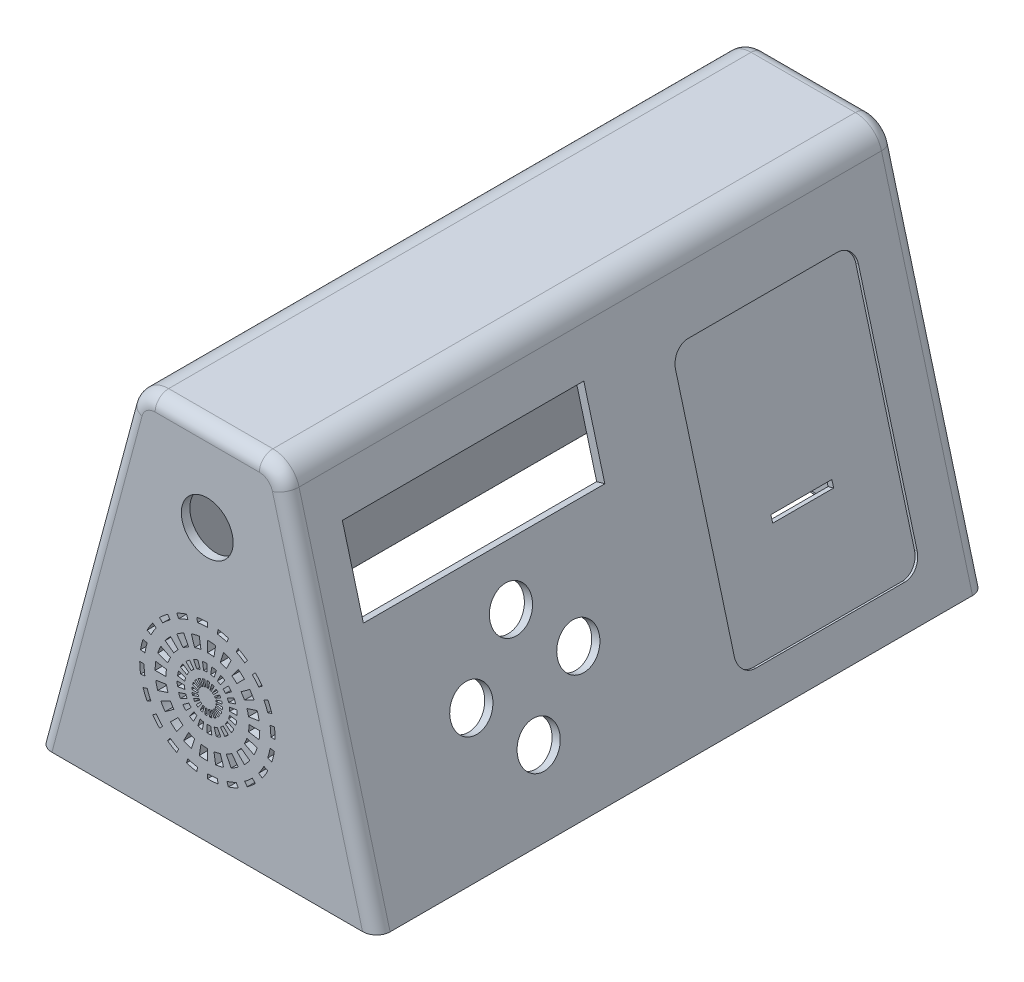
from build123d import *

# Parameters (mm, degrees)
BOSS_EXTRUDE1_DEPTH = 90
SHELL1_T            = -2.5
CUT_EXTRUDE1_REACH  = 163.959
SKETCH2_W           = 71.3
SKETCH2_H           = 24.000000000000014
CUT_EXTRUDE2_DEPTH  = 0.81
CUT_EXTRUDE3_REACH  = 163.615
SKETCH5_W           = 97
SKETCH5_H           = 177
CUT_EXTRUDE4_DEPTH  = 1.5
CUT_EXTRUDE5_REACH  = 163.959
SKETCH6_R           = 6.174999999999999
CUT_EXTRUDE6_DEPTH  = 2.54
CUT_EXTRUDE7_DEPTH  = 2.54
SKETCH14_R          = 20.000000000000004
SKETCH14_R_2        = 19.5
BOSS_EXTRUDE2_DEPTH = 3
FILLET1_R           = 4
FILLET2_R           = 8
SKETCH18_R          = 7.650000000000001
CUT_EXTRUDE8_DEPTH  = 10
CUT_EXTRUDE9_DEPTH  = 10


with BuildPart() as part:
    # Sketch1 → Boss-Extrude1 (new, symmetric)
    with BuildSketch(Plane.XY):
        Polygon((-50, 0), (50, 0), (21.529905038722262, 106.25184089179739), (-21.52990503872305, 106.25184089179761), align=None)
    extrude(amount=BOSS_EXTRUDE1_DEPTH, both=True)

    # Shell1
    shell1_openings = [part.faces().sort_by_distance(p)[0] for p in [
        (0, 0, 0),
    ]]
    offset(amount=SHELL1_T, openings=shell1_openings, kind=Kind.INTERSECTION)

    # Sketch2 → Cut-Extrude1 (cut, up to next)
    with BuildSketch(Plane(origin=(46.65063509461089, 12.500000000000195, 0), x_dir=(0, 0, -1), z_dir=(0.9659258262890673, 0.25881904510252507, 0)), mode=Mode.PRIVATE) as cut_extrude1_sk1:
        with Locations((-40.7193758454218, 66.74047186370007)):
            Rectangle(SKETCH2_W, SKETCH2_H)
    cut_extrude1_tool1 = extrude(cut_extrude1_sk1.sketch, amount=-CUT_EXTRUDE1_REACH, mode=Mode.PRIVATE) & part.part
    add(cut_extrude1_tool1.solids().sort_by_distance((29.37693, 76.966345, 40.719376))[0], mode=Mode.SUBTRACT)

    # Sketch3 → Cut-Extrude2 (cut)
    with BuildSketch(Plane(origin=(46.65063509461089, 12.500000000000195, 0), x_dir=(0, 0, -1), z_dir=(0.9659258262890673, 0.25881904510252507, 0))):
        with BuildLine():
            Line((24.790696850070674, 75.04811729460333), (68.79069685007066, 75.04811729460333))
            ThreePointArc((68.79069685007066, 75.04811729460333), (72.32623075600341, 73.58365120053605), (73.79069685007069, 70.0481172946033))
            Line((73.79069685007069, 70.0481172946033), (73.7906968500707, 3.0481172946033257))
            ThreePointArc((73.7906968500707, 3.0481172946033257), (72.3262307560034, -0.4874166113294116), (68.79069685007066, -1.951882705396674))
            Line((68.79069685007066, -1.951882705396674), (24.79069685007068, -1.9518827053966732))
            ThreePointArc((24.79069685007068, -1.9518827053966732), (21.255162944137943, -0.4874166113294116), (19.79069685007068, 3.0481172946033257))
            Line((19.79069685007068, 3.0481172946033257), (19.790696850070674, 70.0481172946033))
            ThreePointArc((19.790696850070674, 70.0481172946033), (21.255162944137915, 73.58365120053605), (24.790696850070674, 75.04811729460333))
        make_face()
    extrude(amount=-CUT_EXTRUDE2_DEPTH, mode=Mode.SUBTRACT)

    # Sketch4 → Cut-Extrude3 (cut, up to next)
    with BuildSketch(Plane(origin=(45.868235175316755, 12.29035657346716, 0), x_dir=(0, 0, -1), z_dir=(0.9659258262890672, 0.2588190451025251, 0)), mode=Mode.PRIVATE) as cut_extrude3_sk1:
        Polygon((37.79069685007067, 27.800656469375372), (55.79069685007068, 27.800656469375372), (55.790696850070674, 25.80065646937537), (37.790696850070674, 25.80065646937537), align=None)
    cut_extrude3_tool1 = extrude(cut_extrude3_sk1.sketch, amount=-CUT_EXTRUDE3_REACH, mode=Mode.PRIVATE) & part.part
    add(cut_extrude3_tool1.solids().sort_by_distance((38.931715, 38.177803, -46.790697))[0], mode=Mode.SUBTRACT)

    # Sketch5 → Cut-Extrude4 (cut)
    with BuildSketch(Plane.XZ):
        Rectangle(SKETCH5_W, SKETCH5_H)
    extrude(amount=-CUT_EXTRUDE4_DEPTH, mode=Mode.SUBTRACT)

    # Sketch6 → Cut-Extrude5 (cut, up to next)
    with BuildSketch(Plane(origin=(46.65063509461089, 12.500000000000195, 0), x_dir=(0, 0, -1), z_dir=(0.9659258262890673, 0.25881904510252507, 0)), mode=Mode.PRIVATE) as cut_extrude5_sk1:
        with Locations(Location((-36.651313768985446, 39.815157260738054, 0), (0, 0, 90))):
            Circle(SKETCH6_R)
    cut_extrude5_tool1 = extrude(cut_extrude5_sk1.sketch, amount=-CUT_EXTRUDE5_REACH, mode=Mode.PRIVATE) & part.part
    # Sketch6 → Cut-Extrude5 (cut, up to next)
    with BuildSketch(Plane(origin=(46.65063509461089, 12.500000000000195, 0), x_dir=(0, 0, -1), z_dir=(0.9659258262890673, 0.25881904510252507, 0)), mode=Mode.PRIVATE) as cut_extrude5_sk2:
        with Locations(Location((-20.85131376898545, 24.01515726073805, 0), (0, 0, 90))):
            Circle(SKETCH6_R)
    cut_extrude5_tool2 = extrude(cut_extrude5_sk2.sketch, amount=-CUT_EXTRUDE5_REACH, mode=Mode.PRIVATE) & part.part
    # Sketch6 → Cut-Extrude5 (cut, up to next)
    with BuildSketch(Plane(origin=(46.65063509461089, 12.500000000000195, 0), x_dir=(0, 0, -1), z_dir=(0.9659258262890673, 0.25881904510252507, 0)), mode=Mode.PRIVATE) as cut_extrude5_sk3:
        with Locations(Location((-36.651313768985446, 8.21515726073805, 0), (0, 0, 90))):
            Circle(SKETCH6_R)
    cut_extrude5_tool3 = extrude(cut_extrude5_sk3.sketch, amount=-CUT_EXTRUDE5_REACH, mode=Mode.PRIVATE) & part.part
    # Sketch6 → Cut-Extrude5 (cut, up to next)
    with BuildSketch(Plane(origin=(46.65063509461089, 12.500000000000195, 0), x_dir=(0, 0, -1), z_dir=(0.9659258262890673, 0.25881904510252507, 0)), mode=Mode.PRIVATE) as cut_extrude5_sk4:
        with Locations(Location((-52.45131376898545, 24.01515726073805, 0), (0, 0, 90))):
            Circle(SKETCH6_R)
    cut_extrude5_tool4 = extrude(cut_extrude5_sk4.sketch, amount=-CUT_EXTRUDE5_REACH, mode=Mode.PRIVATE) & part.part
    add(cut_extrude5_tool1.solids().sort_by_distance((36.345714, 50.958489, 36.651314))[0], mode=Mode.SUBTRACT)
    add(cut_extrude5_tool2.solids().sort_by_distance((40.435055, 35.696861, 20.851314))[0], mode=Mode.SUBTRACT)
    add(cut_extrude5_tool3.solids().sort_by_distance((44.524396, 20.435233, 36.651314))[0], mode=Mode.SUBTRACT)
    add(cut_extrude5_tool4.solids().sort_by_distance((40.435055, 35.696861, 52.451314))[0], mode=Mode.SUBTRACT)

    # Sketch7 → Cut-Extrude6 (cut)
    with BuildSketch(Plane.XY.offset(90)):
        with BuildLine():
            Line((15.509597701472817, 36.19567201132079), (12.329790586553354, 36.1956720113208))
            ThreePointArc((12.32979058655335, 36.195672011320916), (12.291977318134423, 35.233260063408814), (12.17877064425163, 34.27678170519005))
            Line((12.178770644251635, 34.276781705190146), (15.31942905699906, 33.7793502802366))
            ThreePointArc((15.31942905699913, 33.77935028023699), (15.461982148925589, 34.98377527258352), (15.509597701472819, 36.19567201132091))
        make_face()
        with BuildLine():
            ThreePointArc((11.72942942953246, 39.98620317581368), (11.990868521694535, 39.05921007883732), (12.178770644251646, 38.114562317451686))
            Line((12.178770644251662, 38.114562317451586), (15.319429056999084, 38.61199374240512))
            ThreePointArc((15.319429056999144, 38.611993742404735), (15.082817312908794, 39.80152130777108), (14.753605706738286, 40.968817613158244))
            Line((14.753605706738295, 40.96881761315822), (11.729429429532441, 39.98620317581373))
        make_face()
        with BuildLine():
            ThreePointArc((18.546819101111375, 39.12316210825091), (18.719529034367785, 37.66394325000402), (18.777217568451928, 36.195672011320916))
            Line((18.777217568451928, 36.19567201132078), (20.06337406742318, 36.195672011320774))
            ThreePointArc((20.063374067423187, 36.195672011320916), (20.00172074208575, 37.764853925877745), (19.81714087932596, 39.3243613121254))
            Line((19.817140879325954, 39.3243613121254), (18.54681910111139, 39.12316210825082))
        make_face()
        with BuildLine():
            Line((14.753605706738302, 31.422526409483613), (11.729429429532445, 32.405140846828104))
            ThreePointArc((11.72942942953246, 32.405140846828154), (11.396065226705838, 31.50151763496023), (10.992831214379992, 30.626835445787304))
            Line((10.992831214380132, 30.626835445787577), (13.826060099433963, 29.183233224609925))
            ThreePointArc((13.826060099433962, 29.183233224609907), (14.33382393751374, 30.284658133964008), (14.753605706738288, 31.422526409483588))
        make_face()
        with BuildLine():
            Line((-15.382849566626453, 36.1956720113209), (-12.203042451706985, 36.19567201132089))
            ThreePointArc((-12.203042451706985, 36.195672011320916), (-12.165229183288075, 37.15808395923279), (-12.052022509405335, 38.11456231745134))
            Line((-12.05202250940528, 38.1145623174517), (-15.1926809221527, 38.61199374240525))
            ThreePointArc((-15.192680922152794, 38.61199374240464), (-15.33523401407923, 37.40756875005821), (-15.382849566626453, 36.195672011320916))
        make_face()
        with BuildLine():
            Line((-14.626857571891932, 40.968817613158215), (-11.602681294686079, 39.98620317581373))
            ThreePointArc((-11.602681294686136, 39.98620317581354), (-11.269317091859552, 40.88982638768141), (-10.86608307953375, 41.76450857685428))
            Line((-10.866083079533771, 41.764508576854254), (-13.699311964587606, 43.2081107980319))
            ThreePointArc((-13.69931196458761, 43.208110798031896), (-14.207075802667305, 42.106685888677994), (-14.626857571891797, 40.96881761315862))
        make_face()
        with BuildLine():
            Line((-12.432883351438932, 45.27473446702675), (-9.86036535663471, 43.4056907397424))
            ThreePointArc((-9.860365356634805, 43.40569073974227), (-9.264082230258058, 44.16207227967525), (-8.610292234112105, 44.86933831285688))
            Line((-8.61029223411244, 44.86933831285654), (-10.85875540793723, 47.11780148668133))
            ThreePointArc((-10.858755407937148, 47.117801486681415), (-11.682026529900247, 46.22719180452613), (-12.432883351438809, 45.27473446702691))
        make_face()
        with BuildLine():
            Line((12.559631486285298, 27.116609555615085), (9.987113491481075, 28.985653282899428))
            ThreePointArc((9.987113491481049, 28.985653282899392), (9.390830365104367, 28.229271742966517), (8.737040368958485, 27.522005709784963))
            Line((8.73704036895881, 27.522005709785294), (10.985503542783599, 25.273542535960505))
            ThreePointArc((10.985503542783558, 25.27354253596046), (11.808774664746583, 26.164152218115667), (12.559631486285102, 27.116609555614822))
        make_face()
        with BuildLine():
            Line((-9.015688388282642, 48.69192943018303), (-7.146644660998303, 46.119411435378815))
            ThreePointArc((-7.146644660998346, 46.11941143537878), (-6.345810958030209, 46.65451140822789), (-5.5054624981098375, 47.12512915827803))
            Line((-5.5054624981101545, 47.12512915827787), (-6.949064719287808, 49.9583580433317))
            ThreePointArc((-6.949064719287864, 49.95835804333167), (-8.007255611649487, 49.365742669306954), (-9.015688388282909, 48.69192943018284))
        make_face()
        with BuildLine():
            Line((9.142436523129012, 23.699414592458808), (7.273392795844673, 26.271932587263024))
            ThreePointArc((7.273392795844904, 26.271932587263194), (6.472559092876676, 25.736832614414002), (5.632210632956217, 25.26621486436381))
            Line((5.632210632956529, 25.266214864363974), (7.075812854134185, 22.432985979310136))
            ThreePointArc((7.075812854134246, 22.432985979310168), (8.134003746495864, 23.025601353334878), (9.142436523129273, 23.699414592458993))
        make_face()
        with BuildLine():
            Line((-4.709771534414111, 50.88590365063603), (-3.727157097069624, 47.86172737343018))
            ThreePointArc((-3.72715709706954, 47.861727373430206), (-2.800164000093263, 48.12316646559226), (-1.855516238707713, 48.311068588149354))
            Line((-1.855516238707594, 48.31106858814938), (-2.35294766366114, 51.4517270008968))
            ThreePointArc((-2.3529476636607285, 51.45172700089687), (-3.5424752290270254, 51.21511525680652), (-4.709771534414128, 50.885903650636024))
        make_face()
        with BuildLine():
            Line((4.836519669260483, 21.5054403720058), (3.8539052319159968, 24.529616649211647))
            ThreePointArc((3.853905231915886, 24.52961664921162), (2.9269121349396277, 24.268177557049572), (1.9822643735540888, 24.080275434492474))
            Line((1.9822643735539587, 24.08027543449246), (2.4796957985075045, 20.939617021745043))
            ThreePointArc((2.479695798507099, 20.93961702174497), (3.6692233638733898, 21.17622876583531), (4.836519669260476, 21.5054403720058))
        make_face()
        with BuildLine():
            Line((0.06337406742318387, 51.64189564537055), (0.06337406742318442, 48.462088530451084))
            ThreePointArc((0.06337406742283792, 48.462088530451084), (1.0257860153351275, 48.42427526203217), (1.982264373554086, 48.311068588149354))
            Line((1.982264373553967, 48.31106858814938), (2.479695798507514, 51.4517270008968))
            ThreePointArc((2.4796957985070995, 51.45172700089687), (1.2752708061603342, 51.59428009282334), (0.063374067422697, 51.64189564537055))
        make_face()
        with BuildLine():
            Line((0.06337406742318923, 20.74944837727128), (0.06337406742318867, 23.929255492190748))
            ThreePointArc((0.06337406742371467, 23.929255492190748), (-0.8990378804886597, 23.967068760609656), (-1.8555162387077162, 24.080275434492474))
            Line((-1.8555162387075916, 24.080275434492453), (-2.3529476636611375, 20.939617021745036))
            ThreePointArc((-2.3529476636607387, 20.93961702174497), (-1.1485226713144554, 20.797063929818528), (0.06337406742270008, 20.74944837727128))
        make_face()
        with BuildLine():
            Line((4.836519669260479, 50.88590365063603), (3.8539052319159905, 47.86172737343017))
            ThreePointArc((3.85390523191591, 47.861727373430206), (4.757528443783552, 47.528363170603704), (5.632210632956207, 47.12512915827803))
            Line((5.632210632956522, 47.12512915827787), (7.075812854134175, 49.9583580433317))
            ThreePointArc((7.075812854134234, 49.95835804333167), (5.974387944780107, 50.46612188141147), (4.836519669260496, 50.885903650636024))
        make_face()
        with BuildLine():
            Line((-4.709771534414104, 21.505440372005808), (-3.72715709706962, 24.529616649211654))
            ThreePointArc((-3.7271570970695245, 24.52961664921162), (-4.630780308937182, 24.862980852038127), (-5.505462498109854, 25.266214864363814))
            Line((-5.505462498110155, 25.26621486436396), (-6.949064719287808, 22.43298597931013))
            ThreePointArc((-6.949064719287874, 22.43298597931016), (-5.847639809933736, 21.925222141230364), (-4.709771534414116, 21.5054403720058))
        make_face()
        with BuildLine():
            Line((9.14243652312901, 48.69192943018304), (7.273392795844666, 46.11941143537881))
            ThreePointArc((7.2733927958449005, 46.11941143537864), (8.02977433577733, 45.52312830900232), (8.737040368958487, 44.86933831285687))
            Line((8.737040368958809, 44.86933831285655), (10.985503542783594, 47.11780148668133))
            ThreePointArc((10.985503542783555, 47.11780148668137), (10.09489386062837, 47.94107260864437), (9.142436523129257, 48.69192943018285))
        make_face()
        with BuildLine():
            Line((-9.015688388282639, 23.6994145924588), (-7.1466446609983, 26.271932587263017))
            ThreePointArc((-7.14664466099834, 26.271932587263052), (-7.903026200930869, 26.868215713639437), (-8.61029223411211, 27.522005709784956))
            Line((-8.610292234112444, 27.522005709785287), (-10.85875540793723, 25.2735425359605))
            ThreePointArc((-10.858755407937137, 25.273542535960406), (-9.96814572578198, 24.45027141399744), (-9.0156883882829, 23.699414592458986))
        make_face()
        with BuildLine():
            Line((12.559631486285292, 45.27473446702675), (9.987113491481072, 43.40569073974241))
            ThreePointArc((9.987113491480905, 43.40569073974264), (10.522213464329925, 42.60485703677469), (10.992831214379992, 41.764508576854524))
            Line((10.992831214380129, 41.764508576854254), (13.826060099433969, 43.20811079803191))
            ThreePointArc((13.826060099433965, 43.20811079803192), (13.233444725409242, 44.26630169039356), (12.55963148628511, 45.274734467027))
        make_face()
        with BuildLine():
            Line((-12.432883351438925, 27.11660955561509), (-9.86036535663471, 28.985653282899428))
            ThreePointArc((-9.8603653566348, 28.985653282899555), (-10.395465329483747, 29.786486985867448), (-10.866083079533752, 30.626835445787552))
            Line((-10.86608307953377, 30.626835445787574), (-13.699311964587608, 29.183233224609918))
            ThreePointArc((-13.69931196458761, 29.183233224609936), (-13.106696590562914, 28.125042332248334), (-12.43288335143881, 27.116609555614925))
        make_face()
        with BuildLine():
            Line((-14.626857571891925, 31.422526409483616), (-11.602681294686079, 32.405140846828104))
            ThreePointArc((-11.602681294686137, 32.40514084682829), (-11.864120386848226, 33.33213394380474), (-12.05202250940533, 34.276781705190466))
            Line((-12.052022509405276, 34.2767817051901), (-15.192680922152697, 33.779350280236564))
            ThreePointArc((-15.19268092215279, 33.77935028023717), (-14.956069178062391, 32.589822714870586), (-14.626857571891799, 31.42252640948322))
        make_face()
        with BuildLine():
            Line((19.817140879325944, 33.06698271051631), (18.54681910111137, 33.268181914390894))
            ThreePointArc((18.546819101111353, 33.268181914390794), (18.26015258285303, 31.827012006080583), (17.861296874004175, 30.41277633942955))
            Line((17.861296874004285, 30.41277633942986), (19.08450439332626, 30.01533212382196))
            ThreePointArc((19.084504393326256, 30.015332123821963), (19.51077247537672, 31.52676473420281), (19.817140879325944, 33.066982710516314))
        make_face()
        with BuildLine():
            ThreePointArc((16.73753071947971, 44.69157917440096), (17.352711052642864, 43.357149875038054), (17.861296874004175, 41.97856768321229))
            Line((17.861296874004278, 41.97856768321197), (19.084504393326256, 42.376011898819876))
            ThreePointArc((19.084504393326256, 42.376011898819876), (18.54096471764892, 43.84934065862272), (17.883504551190544, 45.27548200611186))
            Line((17.883504551190537, 45.27548200611185), (16.73753071947988, 44.69157917440063))
        make_face()
        with BuildLine():
            ThreePointArc((-18.420070966265097, 33.26818191439149), (-18.592780899521443, 34.7274007726381), (-18.65046943360556, 36.195672011320916))
            Line((-18.65046943360556, 36.19567201132091), (-19.93662593257682, 36.195672011320916))
            ThreePointArc((-19.93662593257682, 36.195672011320916), (-19.87497260723938, 34.62649009676401), (-19.690392744479574, 33.06698271051629))
            Line((-19.690392744479574, 33.066982710516285), (-18.420070966265, 33.268181914390865))
        make_face()
        with BuildLine():
            Line((-19.690392744479578, 39.32436131212554), (-18.420070966264998, 39.12316210825095))
            ThreePointArc((-18.4200709662651, 39.12316210825031), (-18.13340444800684, 40.56433201656053), (-17.734548739158043, 41.978567683211566))
            Line((-17.734548739157916, 41.97856768321196), (-18.957756258479893, 42.37601189881987))
            ThreePointArc((-18.95775625847989, 42.37601189881987), (-19.38402434053035, 40.86457928843903), (-19.690392744479574, 39.324361312125546))
        make_face()
        with BuildLine():
            Line((-17.75675641634418, 45.27548200611185), (-16.61078258463351, 44.69157917440062))
            ThreePointArc((-16.610782584633345, 44.69157917440096), (-15.892800530990655, 45.97362838092744), (-15.076443354982297, 47.19539323493487))
            Line((-15.076443354982237, 47.195393234934954), (-16.11696582007577, 47.95137705717038))
            ThreePointArc((-16.116965820075766, 47.95137705717038), (-16.989429219658664, 46.645643305639894), (-17.756756416344174, 45.27548200611186))
        make_face()
        with BuildLine():
            Line((17.883504551190548, 27.115862016529977), (16.737530719479885, 27.699764848241205))
            ThreePointArc((16.737530719479714, 27.699764848240875), (16.019548665837025, 26.417715641714402), (15.203191489828669, 25.19595078770697))
            Line((15.203191489828598, 25.195950787706874), (16.243713954922136, 24.439966965471445))
            ThreePointArc((16.243713954922132, 24.43996696547145), (17.11617735450503, 25.745700717001938), (17.88350455119054, 27.115862016529974))
        make_face()
        with BuildLine():
            Line((-14.07876155630777, 50.337807635051874), (-13.169311574218039, 49.42835765296214))
            ThreePointArc((-13.169311574217724, 49.42835765296246), (-12.090295071076216, 50.425790248808724), (-10.936347156190767, 51.3354894337264))
            Line((-10.936347156190854, 51.33548943372633), (-11.692330978426282, 52.37601189881987))
            ThreePointArc((-11.692330978426279, 52.37601189881987), (-12.925586899180491, 51.40379132332154), (-14.078761556307768, 50.337807635051874))
        make_face()
        with BuildLine():
            Line((14.20550969115414, 22.053536387589965), (13.296059709064407, 22.962986369679697))
            ThreePointArc((13.29605970906476, 22.96298636968004), (12.217043205922934, 21.96555377383341), (11.063095291037126, 21.055854588915427))
            Line((11.063095291037227, 21.0558545889155), (11.819079113272652, 20.01533212382197))
            ThreePointArc((11.819079113272643, 20.015332123821963), (13.052335034026862, 20.987552699320297), (14.205509691154132, 22.053536387589958))
        make_face()
        with BuildLine():
            Line((-9.016435927367759, 54.01580249508828), (-8.43253309565653, 52.86982866337762))
            ThreePointArc((-8.432533095656748, 52.869828663377504), (-7.098103796293788, 53.48500899654067), (-5.719521604467964, 53.99359481790198))
            Line((-5.719521604467863, 53.99359481790202), (-6.116965820075766, 55.216802337223996))
            ThreePointArc((-6.116965820075765, 55.216802337223996), (-7.590294579878613, 54.67326266154666), (-9.016435927367752, 54.01580249508828))
        make_face()
        with BuildLine():
            Line((9.143184062214129, 18.375541527553565), (8.559281230502904, 19.52151535926422))
            ThreePointArc((8.55928123050311, 19.521515359264328), (7.224851931140149, 18.90633502610116), (5.846269739314336, 18.397749204739853))
            Line((5.846269739314232, 18.39774920473981), (6.243713954922136, 17.174541685417836))
            ThreePointArc((6.2437139549221286, 17.17454168541784), (7.717042714724984, 17.71808136109518), (9.143184062214132, 18.375541527553562))
        make_face()
        with BuildLine():
            Line((-3.065315233381431, 55.94943882322367), (-2.8641160295068473, 54.67911704500911))
            ThreePointArc((-2.8641160295074557, 54.679117045009), (-1.4048971712602951, 54.85182697826549), (0.06337406742308034, 54.90951551234966))
            Line((0.0633740674231833, 54.90951551234966), (0.06337406742318308, 56.195672011320916))
            ThreePointArc((0.0633740674231843, 56.19567201132092), (-1.5058078471337146, 56.13401868598348), (-3.0653152333814293, 55.94943882322367))
        make_face()
        with BuildLine():
            Line((3.1920633682277972, 16.44190519941816), (2.990864164353211, 17.71222697763274))
            ThreePointArc((2.99086416435382, 17.712226977632827), (1.5316453061065598, 17.539517044376336), (0.06337406742307991, 17.48182851029217))
            Line((0.0633740674231898, 17.481828510292168), (0.06337406742319002, 16.195672011320916))
            ThreePointArc((0.0633740674231794, 16.195672011320912), (1.6325559819800874, 16.257325336658354), (3.1920633682277972, 16.44190519941816))
        make_face()
        with BuildLine():
            Line((3.1920633682278043, 55.949438823223666), (2.9908641643532214, 54.67911704500911))
            ThreePointArc((2.990864164353828, 54.679117045009), (4.432034072663666, 54.39245052675073), (5.846269739314333, 53.99359481790198))
            Line((5.846269739314227, 53.993594817902014), (6.243713954922132, 55.216802337223996))
            ThreePointArc((6.243713954922129, 55.216802337223996), (4.732281344541294, 55.64307041927445), (3.1920633682278066, 55.94943882322367))
        make_face()
        with BuildLine():
            Line((-3.065315233381432, 16.44190519941815), (-2.8641160295068437, 17.71222697763274))
            ThreePointArc((-2.8641160295074606, 17.71222697763283), (-4.305285937817294, 17.998893495891103), (-5.719521604467961, 18.39774920473985))
            Line((-5.719521604467856, 18.39774920473981), (-6.116965820075759, 17.174541685417836))
            ThreePointArc((-6.1169658200757695, 17.174541685417843), (-4.60553320969492, 16.74827360336738), (-3.065315233381438, 16.44190519941816))
        make_face()
        with BuildLine():
            Line((9.143184062214122, 54.01580249508828), (8.559281230502892, 52.86982866337762))
            ThreePointArc((8.559281230503112, 52.869828663377504), (9.841330437029647, 52.15184660973479), (11.063095291037131, 51.3354894337264))
            Line((11.063095291037216, 51.33548943372633), (11.819079113272645, 52.37601189881987))
            ThreePointArc((11.819079113272645, 52.37601189881987), (10.513345361742163, 53.24847529840277), (9.143184062214122, 54.01580249508827))
        make_face()
        with BuildLine():
            Line((-9.016435927367755, 18.37554152755355), (-8.432533095656527, 19.521515359264214))
            ThreePointArc((-8.432533095656751, 19.52151535926433), (-9.714582302183276, 20.23949741290704), (-10.93634715619075, 21.05585458891542))
            Line((-10.93634715619085, 21.055854588915494), (-11.692330978426279, 20.015332123821956))
            ThreePointArc((-11.692330978426284, 20.015332123821967), (-10.386597226895791, 19.142868724239065), (-9.016435927367757, 18.37554152755356))
        make_face()
        with BuildLine():
            Line((14.205509691154132, 50.337807635051874), (13.296059709064407, 49.42835765296215))
            ThreePointArc((13.29605970906476, 49.42835765296179), (14.293492304911004, 48.3493411498203), (15.203191489828662, 47.19539323493487))
            Line((15.203191489828594, 47.19539323493496), (16.24371395492213, 47.95137705717039))
            ThreePointArc((16.243713954922132, 47.95137705717039), (15.2714933794238, 49.1846329779246), (14.20550969115413, 50.337807635051874))
        make_face()
        with BuildLine():
            Line((-14.078761556307773, 22.053536387589958), (-13.16931157421804, 22.962986369679687))
            ThreePointArc((-13.16931157421773, 22.962986369679374), (-14.16674417006433, 24.042002872821175), (-15.076443354982295, 25.19595078770696))
            Line((-15.076443354982228, 25.195950787706874), (-16.116965820075762, 24.43996696547145))
            ThreePointArc((-16.116965820075766, 24.43996696547145), (-15.144745244577434, 23.20671104471724), (-14.078761556307773, 22.053536387589965))
        make_face()
        with BuildLine():
            Line((-17.756756416344178, 27.115862016529974), (-16.610782584633522, 27.699764848241198))
            ThreePointArc((-16.610782584633345, 27.699764848240868), (-17.22596291779664, 29.03419414760412), (-17.73454873915804, 30.412776339430252))
            Line((-17.7345487391579, 30.41277633942987), (-18.95775625847989, 30.01533212382196))
            ThreePointArc((-18.95775625847989, 30.01533212382196), (-18.414216582802553, 28.542003364019113), (-17.756756416344178, 27.11586201652998))
        make_face()
    extrude(amount=-CUT_EXTRUDE6_DEPTH, mode=Mode.SUBTRACT)

    # Sketch8 → Cut-Extrude7 (cut)
    with BuildSketch(Plane.XY.offset(90)):
        with BuildLine():
            Line((4.503210936806557, 36.733163223486926), (2.6365823360693508, 36.733163223486926))
            ThreePointArc((2.6365823360693503, 36.733163223486926), (2.6283620603261064, 36.5239432348104), (2.6037519138298517, 36.316013156936776))
            Line((2.6037519138298446, 36.31601315693676), (4.447399218999401, 36.024008110351645))
            ThreePointArc((4.44739921899941, 36.02400811035167), (4.4892364680430425, 36.377489242736836), (4.503210936806557, 36.733163223486926))
        make_face()
        with BuildLine():
            ThreePointArc((2.5060690410648063, 37.5571917375071), (2.5629036263174405, 37.355671499033946), (2.603751913829859, 37.15031329003703))
            Line((2.603751913829859, 37.15031329003705), (4.447399218999412, 37.442318336622165))
            ThreePointArc((4.447399218999415, 37.44231833662214), (4.3779571302283, 37.7914272919169), (4.281338335298816, 38.13401169732127))
            Line((4.281338335298835, 38.13401169732122), (2.5060690410648077, 37.5571917375071))
        make_face()
        with BuildLine():
            ThreePointArc((6.555741469891258, 37.776246944042185), (6.617279139974874, 37.25631779471364), (6.637833939059922, 36.733163223486926))
            Line((6.637833939059922, 36.733163223486926), (8.834200022724662, 36.733163223486926))
            ThreePointArc((8.834200022724662, 36.733163223486926), (8.806874560003799, 37.4286426915253), (8.72506664240552, 38.119834297372826))
            Line((8.72506664240552, 38.119834297372826), (6.555741469891251, 37.776246944042235))
        make_face()
        with BuildLine():
            Line((-4.563270838202682, 36.733163223486926), (-2.6966422374654755, 36.733163223486926))
            ThreePointArc((-2.696642237465476, 36.733163223486926), (-2.6884219617222302, 36.94238321216348), (-2.6638118152259684, 37.15031329003713))
            Line((-2.6638118152259764, 37.1503132900371), (-4.507459120395532, 37.442318336622215))
            ThreePointArc((-4.50745912039552, 37.44231833662228), (-4.549296369439164, 37.088837204237066), (-4.563270838202682, 36.733163223486926))
        make_face()
        with BuildLine():
            Line((-4.341398236694959, 38.13401169732122), (-2.5661289424609324, 37.55719173750709))
            ThreePointArc((-2.566128942460939, 37.557191737507075), (-2.493658463585617, 37.753631566173944), (-2.405998895688734, 37.943779868167994))
            Line((-2.4059988956886933, 37.94377986816807), (-4.069177157182152, 38.791211519444886))
            ThreePointArc((-4.069177157182104, 38.79121151944498), (-4.218198422606871, 38.46795940605499), (-4.341398236694969, 38.134011697321185))
        make_face()
        with BuildLine():
            Line((4.281338335298825, 35.332314749652625), (2.5060690410648068, 35.90913470946675))
            ThreePointArc((2.5060690410648014, 35.90913470946674), (2.4335985621894745, 35.712694880799866), (2.3459389942925877, 35.522546578805816))
            Line((2.3459389942925597, 35.522546578805766), (4.009117255786014, 34.67511492752895))
            ThreePointArc((4.009117255786027, 34.67511492752897), (4.1581385212107485, 34.99836704091887), (4.281338335298814, 35.33231474965258))
        make_face()
        with BuildLine():
            Line((-3.6974988682846712, 39.397735362251375), (-2.1873646081019427, 38.30055859923071))
            ThreePointArc((-2.18736460810193, 38.30055859923073), (-2.0577378414983216, 38.46498936878134), (-1.9156095814666316, 38.618742854255565))
            Line((-1.9156095814666667, 38.61874285425553), (-3.2355153230047016, 39.938648595793566))
            ThreePointArc((-3.235515323004686, 39.93864859579358), (-3.477133365058535, 39.67726767048741), (-3.6974988682846486, 39.39773536225141))
        make_face()
        with BuildLine():
            Line((3.6374389668885394, 34.068591084722456), (2.1273047067058135, 35.16576784774312))
            ThreePointArc((2.12730470670578, 35.16576784774308), (1.997677940102193, 35.00133707819251), (1.8555496800705296, 34.84758359271831))
            Line((1.8555496800705402, 34.84758359271832), (3.175455421608577, 33.527677851180286))
            ThreePointArc((3.1754554216086754, 33.527677851180385), (3.4170734636624607, 33.7890587764865), (3.6374389668885194, 34.068591084722435))
        make_face()
        with BuildLine():
            Line((-2.6946020894625207, 40.40063214107353), (-1.5974253264418556, 38.890497880890806))
            ThreePointArc((-1.597425326441834, 38.89049788089082), (-1.4233310431879804, 39.00682396194492), (-1.2406465953793027, 39.10913216847751))
            Line((-1.2406465953792187, 39.10913216847756), (-2.0880782466560333, 40.772310429971014))
            ThreePointArc((-2.088078246655972, 40.77231042997104), (-2.398641807930844, 40.59838647886558), (-2.694602089462505, 40.400632141073544))
        make_face()
        with BuildLine():
            Line((2.634542188066396, 33.06569430590032), (1.5373654250457314, 34.57582856608305))
            ThreePointArc((1.5373654250457656, 34.575828566083075), (1.363271141791888, 34.459502485028956), (1.1805866939831853, 34.357194278496344))
            Line((1.1805866939830887, 34.3571942784963), (2.028018345259909, 32.69401601700284))
            ThreePointArc((2.028018345259844, 32.69401601700281), (2.3385819065347384, 32.86793996810829), (2.634542188066417, 33.06569430590034))
        make_face()
        with BuildLine():
            Line((-1.4308784245323622, 41.044531509483825), (-0.8540584647182365, 39.269262215249796))
            ThreePointArc((-0.8540584647182847, 39.26926221524978), (-0.652538226245091, 39.32609680050243), (-0.447180017248139, 39.36694508801485))
            Line((-0.4471800172482311, 39.36694508801484), (-0.7391850638333511, 41.21059239318439))
            ThreePointArc((-0.739185063833355, 41.21059239318439), (-1.088294019128091, 41.14115030441327), (-1.4308784245324413, 41.04453150948379))
        make_face()
        with BuildLine():
            Line((1.370818523136231, 32.42179493749004), (0.7939985633221056, 34.19706423172406))
            ThreePointArc((0.7939985633221577, 34.19706423172407), (0.5924783248489638, 34.140229646471425), (0.3871201158520148, 34.099381358959))
            Line((0.38712011585210404, 34.099381358959015), (0.6791251624372243, 32.25573405378946))
            ThreePointArc((0.6791251624372308, 32.25573405378946), (1.0282341177319647, 32.32517614256058), (1.3708185231363172, 32.42179493749006))
        make_face()
        with BuildLine():
            Line((-0.0300299506980628, 41.266404110991544), (-0.0300299506980628, 39.39977551025434))
            ThreePointArc((-0.03002995069814612, 39.39977551025434), (0.17919003797838373, 39.3915552345111), (0.3871201158520172, 39.36694508801485))
            Line((0.38712011585210526, 39.36694508801484), (0.679125162437223, 41.21059239318439))
            ThreePointArc((0.6791251624372289, 41.21059239318439), (0.3256440300520442, 41.25242964222803), (-0.03002995069806554, 41.266404110991544))
        make_face()
        with BuildLine():
            Line((-0.0300299506980628, 32.19992233598231), (-0.0300299506980628, 34.066550936719516))
            ThreePointArc((-0.0300299506979804, 34.066550936719516), (-0.23924993937450437, 34.07477121246275), (-0.447180017248132, 34.099381358959))
            Line((-0.4471800172482232, 34.099381358959015), (-0.7391850638333413, 32.25573405378946))
            ThreePointArc((-0.73918506383335, 32.25573405378946), (-0.38570393144817133, 32.21389680474582), (-0.03002995069806363, 32.19992233598231))
        make_face()
        with BuildLine():
            Line((1.3708185231362366, 41.044531509483825), (0.7939985633221109, 39.269262215249796))
            ThreePointArc((0.7939985633221595, 39.26926221524978), (0.9904383919890847, 39.19679173637443), (1.1805866939831837, 39.10913216847751))
            Line((1.1805866939830882, 39.109132168477544), (2.0280183452599063, 40.772310429971014))
            ThreePointArc((2.028018345259845, 40.77231042997104), (1.7047662318699792, 40.92133169539574), (1.3708185231363164, 41.04453150948379))
        make_face()
        with BuildLine():
            Line((-1.4308784245323567, 32.42179493749004), (-0.8540584647182312, 34.19706423172406))
            ThreePointArc((-0.8540584647182842, 34.19706423172407), (-1.0504982933852045, 34.26953471059942), (-1.240646595379301, 34.357194278496344))
            Line((-1.2406465953792143, 34.35719427849629), (-2.088078246656025, 32.69401601700284))
            ThreePointArc((-2.088078246655964, 32.69401601700281), (-1.7648261332661026, 32.54499475157811), (-1.4308784245324444, 32.42179493749006))
        make_face()
        with BuildLine():
            Line((2.634542188066398, 40.40063214107353), (1.5373654250457345, 38.890497880890806))
            ThreePointArc((1.5373654250457698, 38.89049788089078), (1.7017961945963354, 38.7608711142872), (1.8555496800705316, 38.618742854255544))
            Line((1.8555496800705482, 38.61874285425553), (3.17545542160858, 39.938648595793566))
            ThreePointArc((3.175455421608683, 39.93864859579346), (2.914074496302471, 40.18026663784736), (2.6345421880664195, 40.400632141073515))
        make_face()
        with BuildLine():
            Line((-2.694602089462517, 33.06569430590032), (-1.5974253264418508, 34.57582856608305))
            ThreePointArc((-1.5974253264418325, 34.57582856608303), (-1.7618560959924143, 34.70545533268662), (-1.9156095814666263, 34.84758359271828))
            Line((-1.915609581466664, 34.847583592718316), (-3.235515323004697, 33.52767785118028))
            ThreePointArc((-3.235515323004681, 33.527677851180265), (-2.974134397698508, 33.28605980912642), (-2.6946020894625047, 33.06569430590031))
        make_face()
        with BuildLine():
            Line((3.637438966888538, 39.39773536225139), (2.1273047067058073, 38.30055859923072))
            ThreePointArc((2.1273047067057873, 38.300558599230754), (2.2436307877599506, 38.126464315976804), (2.3459389942925952, 37.94377986816802))
            Line((2.3459389942925695, 37.94377986816807), (4.009117255786021, 38.791211519444886))
            ThreePointArc((4.009117255786034, 38.791211519444865), (3.8351933046805664, 39.10177508071975), (3.637438966888524, 39.39773536225141))
        make_face()
        with BuildLine():
            Line((-3.6974988682846686, 34.06859108472247), (-2.1873646081019427, 35.16576784774313))
            ThreePointArc((-2.187364608101926, 35.16576784774311), (-2.303690689156086, 35.33986213099706), (-2.4059988956887275, 35.522546578805844))
            Line((-2.4059988956886906, 35.522546578805766), (-4.069177157182147, 34.67511492752895))
            ThreePointArc((-4.069177157182191, 34.675114927529044), (-3.895253206076707, 34.36455136625413), (-3.6974988682846446, 34.068591084722435))
        make_face()
        with BuildLine():
            Line((-4.3413982366949515, 35.332314749652625), (-2.566128942460926, 35.909134709466755))
            ThreePointArc((-2.566128942460937, 35.90913470946677), (-2.6229635277135523, 36.11065494793986), (-2.663811815225964, 36.31601315693669))
            Line((-2.663811815225964, 36.316013156936734), (-4.50745912039552, 36.024008110351616))
            ThreePointArc((-4.5074591203955165, 36.02400811035156), (-4.438017031624417, 35.67489915505692), (-4.341398236694966, 35.33231474965266))
        make_face()
        with BuildLine():
            Line((8.72506664240551, 35.34649214960097), (6.555741469891235, 35.69007950293157))
            ThreePointArc((6.555741469891249, 35.69007950293162), (6.4536003290084505, 35.17658131160072), (6.311485451425403, 34.67267996537262))
            Line((6.3114854514254155, 34.67267996537266), (8.400353727464438, 33.9939655196515))
            ThreePointArc((8.40035372746443, 33.993965519651496), (8.58928064294569, 34.66384983203883), (8.725066642405512, 35.34649214960097))
        make_face()
        with BuildLine():
            ThreePointArc((5.91108027747636, 39.76031008299337), (6.130273022620441, 39.284844263362736), (6.311485451425408, 38.793646481601215))
            Line((6.311485451425417, 38.79364648160118), (8.400353727464433, 39.472360927322335))
            ThreePointArc((8.400353727464436, 39.472360927322335), (8.159450693220261, 40.12535717498984), (7.868056787527671, 40.75743941892737))
            Line((7.868056787527666, 40.75743941892737), (5.911080277476334, 39.76031008299343))
        make_face()
        with BuildLine():
            ThreePointArc((-6.6158013712874, 35.69007950293178), (-6.677339041371004, 36.21000865226027), (-6.697893840456047, 36.733163223486926))
            Line((-6.697893840456047, 36.733163223486926), (-8.894259924120789, 36.733163223486926))
            ThreePointArc((-8.894259924120789, 36.733163223486926), (-8.866934461399923, 36.03768375544852), (-8.785126543801637, 35.346492149600955))
            Line((-8.785126543801637, 35.346492149600955), (-6.615801371287358, 35.69007950293155))
        make_face()
        with BuildLine():
            Line((-8.785126543801637, 38.11983429737289), (-6.6158013712873665, 37.77624694404229))
            ThreePointArc((-6.615801371287402, 37.776246944042065), (-6.513660230404627, 38.289745135372925), (-6.371545352821608, 38.79364648160099))
            Line((-6.371545352821544, 38.79364648160118), (-8.460413628860561, 39.472360927322335))
            ThreePointArc((-8.460413628860563, 39.472360927322335), (-8.649340544341817, 38.80247661493502), (-8.785126543801637, 38.11983429737289))
        make_face()
        with BuildLine():
            Line((-7.928116688923794, 40.75743941892737), (-5.971140178872459, 39.76031008299342))
            ThreePointArc((-5.971140178872551, 39.76031008299324), (-5.715318513552086, 40.21711253560668), (-5.424445153691325, 40.65243528218018))
            Line((-5.424445153691317, 40.65243528218019), (-7.201342641244836, 41.9434268747937))
            ThreePointArc((-7.201342641244839, 41.9434268747937), (-7.588028452109688, 41.36471066191239), (-7.928116688923797, 40.757439418927376))
        make_face()
        with BuildLine():
            Line((7.868056787527667, 32.70888702804646), (5.911080277476323, 33.70601636398041))
            ThreePointArc((5.911080277476353, 33.70601636398047), (5.655258612155883, 33.24921391136704), (5.364385252295117, 32.81389116479356))
            Line((5.364385252295185, 32.813891164793645), (7.1412827398487115, 31.52289957218013))
            ThreePointArc((7.1412827398487, 31.522899572180133), (7.5279685507135525, 32.10161578506145), (7.868056787527664, 32.70888702804646))
        make_face()
        with BuildLine():
            Line((-6.297987074902318, 43.001120347691185), (-4.744921723174842, 41.44805499596371))
            ThreePointArc((-4.744921723174793, 41.44805499596376), (-4.360461140432694, 41.80344670306792), (-3.94930200939139, 42.127578426480135))
            Line((-3.9493020093913325, 42.12757842648018), (-5.240293602004842, 43.904475914033696))
            ThreePointArc((-5.240293602004845, 43.904475914033696), (-5.78688680688737, 43.47357657572817), (-6.297987074902322, 43.001120347691185))
        make_face()
        with BuildLine():
            Line((6.237927173506195, 30.46520609928266), (4.684861821778712, 32.01827145101015))
            ThreePointArc((4.684861821778847, 32.01827145101027), (4.300401239036676, 31.66287974390602), (3.889242107995285, 31.338748020493735))
            Line((3.889242107995207, 31.33874802049368), (5.180233700608715, 29.56185053294016))
            ThreePointArc((5.180233700608714, 29.561850532940152), (5.726826905491237, 29.992749871245678), (6.23792717350619, 30.46520609928266))
        make_face()
        with BuildLine():
            Line((-4.054306146138515, 44.631249961712655), (-3.0571768102045658, 42.674273451661314))
            ThreePointArc((-3.057176810204634, 42.674273451661286), (-2.5817109905739204, 42.893466196805406), (-2.0905132088123204, 43.0746786256104))
            Line((-2.0905132088123213, 43.0746786256104), (-2.7692276545334753, 45.163546901649426))
            ThreePointArc((-2.769227654533475, 45.163546901649426), (-3.4222239022009795, 44.92264386740525), (-4.054306146138515, 44.631249961712655))
        make_face()
        with BuildLine():
            Line((3.994246244742392, 28.835076485261194), (2.9971169088084446, 30.79205299531253))
            ThreePointArc((2.9971169088085103, 30.792052995312567), (2.5216510891777957, 30.572860250168443), (2.030453307416194, 30.391647821363446))
            Line((2.0304533074161926, 30.391647821363453), (2.7091677531373497, 28.30277954532442))
            ThreePointArc((2.709167753137346, 28.302779545324427), (3.362164000804856, 28.543682579568603), (3.994246244742388, 28.835076485261194))
        make_face()
        with BuildLine():
            Line((-1.4167010245840286, 45.48825981659049), (-1.073113671253429, 43.318934644076236))
            ThreePointArc((-1.073113671253319, 43.31893464407625), (-0.5531845219247922, 43.38047231415986), (-0.03002995069810385, 43.40102711324491))
            Line((-0.0300299506980628, 43.40102711324491), (-0.0300299506980628, 45.59739319690964))
            ThreePointArc((-0.03002995069806226, 45.59739319690965), (-0.7255094187364702, 45.57006773418878), (-1.41670102458403, 45.4882598165905))
        make_face()
        with BuildLine():
            Line((1.356641123187903, 27.97806663038335), (1.013053769857301, 30.147391802897623))
            ThreePointArc((1.013053769857188, 30.147391802897605), (0.4931246205286185, 30.085854132813985), (-0.03002995069810548, 30.06529933372894))
            Line((-0.0300299506980628, 30.06529933372894), (-0.0300299506980628, 27.868933250064195))
            ThreePointArc((-0.03002995069806443, 27.868933250064202), (0.6654495173403456, 27.896258712785066), (1.3566411231878994, 27.978066630383353))
        make_face()
        with BuildLine():
            Line((1.356641123187896, 45.4882598165905), (1.0130537698572981, 43.318934644076236))
            ThreePointArc((1.0130537698571882, 43.31893464407625), (1.5265519611880882, 43.21679350319345), (2.0304533074161957, 43.0746786256104))
            Line((2.0304533074161957, 43.0746786256104), (2.7091677531373497, 45.163546901649426))
            ThreePointArc((2.709167753137348, 45.163546901649426), (2.0392834407500247, 45.35247381713068), (1.3566411231878956, 45.4882598165905))
        make_face()
        with BuildLine():
            Line((-1.4167010245840146, 27.97806663038335), (-1.0731136712534157, 30.147391802897623))
            ThreePointArc((-1.0731136712533045, 30.1473918028976), (-1.586611862584209, 30.249532943780398), (-2.0905132088123217, 30.391647821363446))
            Line((-2.090513208812318, 30.391647821363453), (-2.7692276545334753, 28.30277954532442))
            ThreePointArc((-2.769227654533475, 28.302779545324427), (-2.099343342146151, 28.113852629843173), (-1.4167010245840206, 27.978066630383353))
        make_face()
        with BuildLine():
            Line((3.994246244742386, 44.63124996171266), (2.9971169088084366, 42.674273451661314))
            ThreePointArc((2.997116908808509, 42.674273451661286), (3.4539193614218666, 42.41845178634084), (3.8892421079952935, 42.12757842648011))
            Line((3.8892421079952086, 42.12757842648018), (5.180233700608723, 43.9044759140337))
            ThreePointArc((5.180233700608719, 43.904475914033696), (4.601517487727403, 44.29116172489855), (3.9942462447423854, 44.63124996171266))
        make_face()
        with BuildLine():
            Line((-4.0543061461385035, 28.83507648526119), (-3.0571768102045613, 30.792052995312524))
            ThreePointArc((-3.0571768102046275, 30.792052995312563), (-3.5139792628179722, 31.047874660633), (-3.949302009391384, 31.338748020493714))
            Line((-3.949302009391327, 31.338748020493675), (-5.240293602004841, 29.56185053294015))
            ThreePointArc((-5.240293602004844, 29.561850532940152), (-4.6615773891235275, 29.1751647220753), (-4.05430614613851, 28.83507648526119))
        make_face()
        with BuildLine():
            Line((6.237927173506196, 43.001120347691185), (4.684861821778717, 41.4480549959637))
            ThreePointArc((4.684861821778849, 41.448054995963574), (5.040253528882959, 41.06359441322153), (5.36438525229512, 40.652435282180285))
            Line((5.364385252295181, 40.6524352821802), (7.141282739848705, 41.943426874793715))
            ThreePointArc((7.1412827398487035, 41.943426874793715), (6.710383401543178, 42.490020079676235), (6.237927173506195, 43.001120347691185))
        make_face()
        with BuildLine():
            Line((-6.297987074902317, 30.465206099282657), (-4.744921723174836, 32.018271451010136))
            ThreePointArc((-4.7449217231747856, 32.01827145101009), (-5.100313430279041, 32.40273203375227), (-5.424445153691325, 32.813891164793674))
            Line((-5.4244451536913125, 32.81389116479365), (-7.201342641244832, 31.522899572180144))
            ThreePointArc((-7.201342641244835, 31.522899572180144), (-6.770443302939304, 30.976306367297617), (-6.297987074902318, 30.46520609928266))
        make_face()
        with BuildLine():
            Line((-7.928116688923793, 32.70888702804647), (-5.971140178872457, 33.70601636398041))
            ThreePointArc((-5.971140178872544, 33.706016363980595), (-6.190332924016635, 34.18148218361129), (-6.371545352821606, 34.672679965372865))
            Line((-6.371545352821537, 34.672679965372666), (-8.46041362886056, 33.99396551965151))
            ThreePointArc((-8.460413628860563, 33.99396551965151), (-8.219510594616386, 33.34096927198401), (-7.928116688923792, 32.70888702804647))
        make_face()
    extrude(amount=-CUT_EXTRUDE7_DEPTH, mode=Mode.SUBTRACT)

    # Sketch14 → Boss-Extrude2 (add)
    with BuildSketch(Plane(origin=(0, 0, 87.5), x_dir=(-1, 0, 0), z_dir=(0, 0, -1))):
        with Locations(Location((0.0300299506980628, 36.733163223486926, 0), (0, 0, 181.539984311))):
            Circle(SKETCH14_R)
        with Locations(Location((0.0300299506980628, 36.733163223486926, 0), (0, 0, 181.579480968))):
            Circle(SKETCH14_R_2, mode=Mode.SUBTRACT)
    extrude(amount=BOSS_EXTRUDE2_DEPTH)

    # Fillet1
    fillet1_edges = [part.edges().sort_by_distance(p)[0] for p in [
        (35.76495251936113, 53.12592044589869, 90),
        (-3.9435e-13, 106.2518408917975, 90),
        (-35.76495251936153, 53.12592044589881, 90),
        (-3.9435e-13, 106.2518408917975, -90),
        (35.76495251936113, 53.12592044589869, -90),
        (-35.76495251936153, 53.12592044589881, -90),
    ]]
    fillet(fillet1_edges, radius=FILLET1_R)

    # Fillet2
    # the kernel refuses this fillet: 8 mm, written as the material it takes off along each edge
    with BuildSketch(Plane(origin=(15.391289134890597, 98.25184089179741, -90), x_dir=(5.28e-15, 1, 0), z_dir=(-1, 5.28e-15, 0))) as fillet2_piece_1:
        with BuildLine():
            CenterArc((4, -4), 4, 0, 90)
            Line((8, -4), (8, 0))
            Line((8, 0), (4, 0))
        make_face()
    revolve(axis=Axis((15.391289134890597, 98.25184089179741, -90), (0, 0, -1)), revolution_arc=74.99999999999946, mode=Mode.SUBTRACT)
    with BuildSketch(Plane(origin=(-15.391289134891355, 98.25184089179758, -90), x_dir=(-0.9659258262890692, 0.25881904510251774, 0), z_dir=(-0.25881904510251774, -0.9659258262890692, 0))) as fillet2_piece_2:
        with BuildLine():
            CenterArc((4, -4), 4, 0, 90)
            Line((8, -4), (8, 0))
            Line((8, 0), (4, 0))
        make_face()
    revolve(axis=Axis((-15.391289134891355, 98.25184089179758, -90), (0, 0, -1)), revolution_arc=75.00000000000048, mode=Mode.SUBTRACT)
    with BuildSketch(Plane(origin=(-15.391289134891355, 98.25184089179758, 90), x_dir=(5.28e-15, 1, 0), z_dir=(1, -5.28e-15, 0))) as fillet2_piece_3:
        with BuildLine():
            CenterArc((4, -4), 4, 0, 90)
            Line((8, -4), (8, 0))
            Line((8, 0), (4, 0))
        make_face()
    revolve(axis=Axis((-15.391289134891355, 98.25184089179758, 90), (0, 0, 1)), revolution_arc=75.00000000000048, mode=Mode.SUBTRACT)
    with BuildSketch(Plane(origin=(15.391289134890597, 98.25184089179741, 90), x_dir=(0.9659258262890672, 0.25881904510252496, 0), z_dir=(0.25881904510252496, -0.9659258262890672, 0))) as fillet2_piece_4:
        with BuildLine():
            CenterArc((4, -4), 4, 0, 90)
            Line((8, -4), (8, 0))
            Line((8, 0), (4, 0))
        make_face()
    revolve(axis=Axis((15.391289134890597, 98.25184089179741, 90), (0, 0, 1)), revolution_arc=74.99999999999946, mode=Mode.SUBTRACT)
    with BuildSketch(Plane(origin=(-21.52990503872305, 106.25184089179761, 90), x_dir=(-0.2588190451025178, -0.9659258262890691, 0), z_dir=(0, 0, -1))) as fillet2_piece_5:
        with BuildLine():
            CenterArc((FILLET2_R * 0.767326987979, -FILLET2_R), FILLET2_R, 90.00000000000003, 75.00000000000045)
            Line((-FILLET2_R * 0.19859883831, -FILLET2_R * 0.741180954897), (0, 0))
            Line((0, 0), (FILLET2_R * 0.767326987979, -1.6e-16))
        make_face()
    extrude(amount=180, mode=Mode.SUBTRACT)
    with BuildSketch(Plane(origin=(21.529905038722255, 106.25184089179739, -90), x_dir=(-1, 4.63e-15, 0), z_dir=(0, 0, 1))) as fillet2_piece_6:
        with BuildLine():
            CenterArc((FILLET2_R * 0.767326987979, FILLET2_R), FILLET2_R, 195.00000000000063, 74.99999999999932)
            Line((-FILLET2_R * 0.19859883831, FILLET2_R * 0.741180954897), (0, 0))
            Line((0, 0), (FILLET2_R * 0.767326987979, 0))
        make_face()
    extrude(amount=180, mode=Mode.SUBTRACT)

    # Sketch18 → Cut-Extrude8 (cut)
    with BuildSketch(Plane.XY.offset(90)):
        with Locations((0, 80.37016280179229)):
            Circle(SKETCH18_R)
    extrude(amount=-CUT_EXTRUDE8_DEPTH, mode=Mode.SUBTRACT)

    # Sketch19 → Cut-Extrude9 (cut)
    with BuildSketch(Plane(origin=(0, 0, -90), x_dir=(-1, 0, 0), z_dir=(0, 0, -1))):
        with BuildLine():
            Line((-19.527909240177866, 21.96115608574008), (-28.93893699941593, 21.96115608574008))
            ThreePointArc((-28.93893699941593, 21.96115608574008), (-34.1334231197969, 13.250924221506343), (-28.93893699941593, 4.540692357272604))
            Line((-28.93893699941593, 4.540692357272606), (-19.527909240177866, 4.540692357272608))
            ThreePointArc((-19.527909240177866, 4.540692357272606), (-15.730641592313422, 8.180154428281078), (-14.333423119796898, 13.25092422150634))
            ThreePointArc((-14.333423119796898, 13.250924221506342), (-15.730641592313424, 18.321694014731605), (-19.527909240177866, 21.96115608574008))
        make_face()
    extrude(amount=-CUT_EXTRUDE9_DEPTH, mode=Mode.SUBTRACT)


solid = part.part
